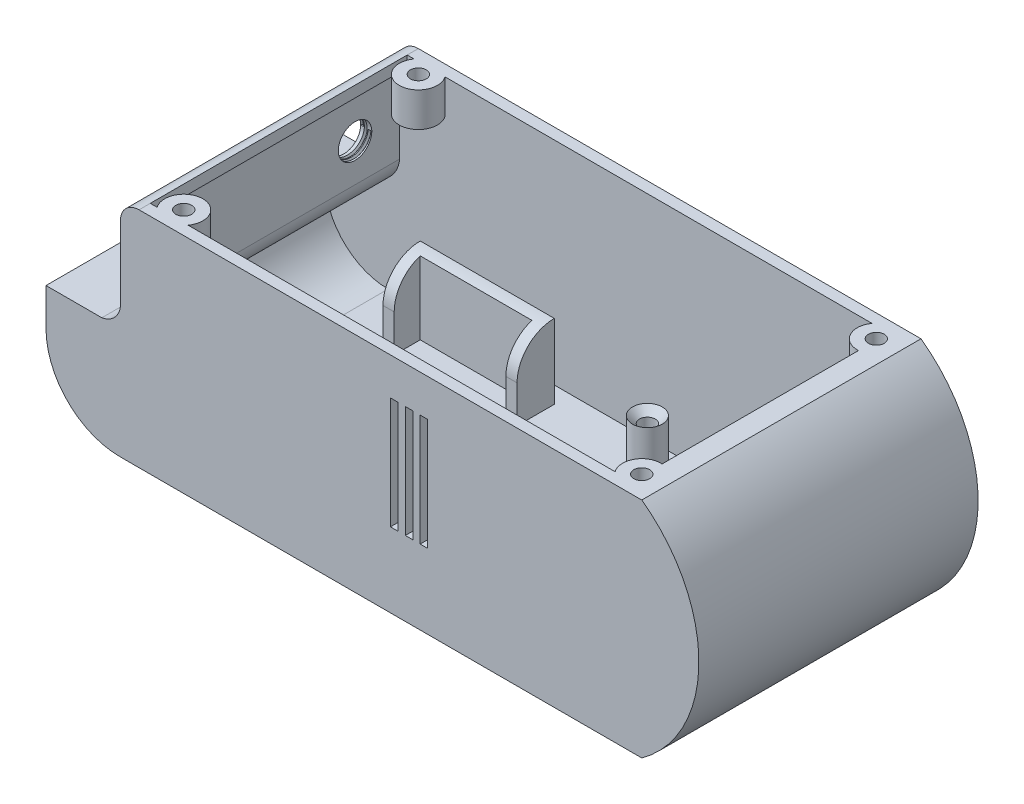
from build123d import *

# Parameters (mm, degrees)
BOSS_EXTRUDE1_DEPTH                               = 37.5
F_4_0MM_DOWEL_HOLE1_D                             = 4.25
F_4_0MM_DOWEL_HOLE1_DEPTH                         = 7.523171185
F_4_0MM_DOWEL_HOLE1_TIP                           = 1.276828815
SHELL1_START                                      = -34.5
SHELL1_DEPTH                                      = 69
SKETCH13_R                                        = 4
BOSS_EXTRUDE2_DEPTH                               = 15
CSK_FOR_M3_5_FLAT_HEAD_MACHINE_SCREW1_D           = 4.25
CSK_FOR_M3_5_FLAT_HEAD_MACHINE_SCREW1_DEPTH       = 8.723171185
CSK_FOR_M3_5_FLAT_HEAD_MACHINE_SCREW1_CSINK_D     = 8.2
CSK_FOR_M3_5_FLAT_HEAD_MACHINE_SCREW1_CSINK_ANGLE = 90
CSK_FOR_M3_5_FLAT_HEAD_MACHINE_SCREW1_TIP         = 1.276828815
BOSS_EXTRUDE3_DEPTH                               = 20
BOSS_EXTRUDE4_DEPTH                               = 20
FILLET1_R                                         = 10
FILLET2_R                                         = 10
SKETCH24_R                                        = 4.5
CUT_EXTRUDE2_DEPTH                                = 5
THREAD1_PITCH                                     = 1
SKETCH35_W                                        = 2
SKETCH35_H                                        = 30
CUT_EXTRUDE3_DEPTH                                = 5


with BuildPart() as part:
    # Sketch2 → Boss-Extrude1 (new, symmetric)
    with BuildSketch(Plane.XY):
        with BuildLine():
            Line((0, 0), (0, 20))
            ThreePointArc((0, 20), (1.464466094, 23.535533906), (5, 25))
            Line((5, 25), (140, 25))
            ThreePointArc((140, 25), (155.343592172, -5), (140, -35))
            Line((140, -35), (9.888535261, -35))
            Line((9.888535261, -35), (-0.111464739, -35))
            ThreePointArc((-0.111464739, -35), (-14.17478289, -29.17478289), (-20, -15.111464739))
            Line((-20, -15.111464739), (-20, -5.111464739))
            Line((-20, -5.111464739), (-5, -5.111464739))
            ThreePointArc((-5, -5.111464739), (-1.655416522, -3.381898176), (0, 0))
        make_face()
    extrude(amount=BOSS_EXTRUDE1_DEPTH, both=True)

    # Ø4.0mm Dowel Hole1
    with Locations(Plane(origin=(0, 25, 0), x_dir=(1, 0, 0), z_dir=(0, 1, 0))):
        with Locations((11, 31.5), (11, -31.5), (134, -31.5), (134, 31.5)):
            Hole(F_4_0MM_DOWEL_HOLE1_D / 2, depth=F_4_0MM_DOWEL_HOLE1_DEPTH)
            with Locations((0, 0, -(F_4_0MM_DOWEL_HOLE1_DEPTH + F_4_0MM_DOWEL_HOLE1_TIP / 2))):  # 118° drill point
                Cone(0, F_4_0MM_DOWEL_HOLE1_D / 2, F_4_0MM_DOWEL_HOLE1_TIP, mode=Mode.SUBTRACT)

    # Shell1: read off the stored shape, not the designer's step
    # Shell1 outline → Shell1 (cut)
    with BuildSketch(Plane.XY.offset(SHELL1_START)):
        with BuildLine():
            Line((5, 25), (5, 22))
            ThreePointArc((5, 22), (3.585786438, 21.414213562), (3, 20))
            Line((3, 20), (3, -0.183649605))
            ThreePointArc((3, -0.183649605), (0.476363339, -5.492759933), (-4.786504663, -8.111464739))
            Line((-4.786504663, -8.111464739), (-17, -8.111464739))
            Line((-17, -8.111464739), (-17, -15.111464739))
            ThreePointArc((-17, -15.111464739), (-12.053462546, -27.053462546), (-0.111464739, -32))
            Line((-0.111464739, -32), (139.007570492, -32))
            ThreePointArc((139.007570492, -32), (152.230342187, -2.227244432), (134.343592172, 25))
            Line((134.343592172, 25), (5, 25))
        make_face()
    extrude(amount=SHELL1_DEPTH, mode=Mode.SUBTRACT)

    # Shell1 2 outline → Shell1 2 (revolve)
    with BuildSketch(Plane(origin=(134, 0, -31.5), x_dir=(1, 0, 0), z_dir=(0, 0, 1))):
        Polygon((0, 12.700099808), (5.125, 15.779510481), (5.125, 25), (2.125, 25), (2.125, 17.476828815), (0, 16.2), align=None)
    revolve(axis=Axis((134, 0, -31.5), (0, 1, 0)))

    # Shell1 3 outline → Shell1 3 (revolve)
    with BuildSketch(Plane(origin=(134, 0, 31.5), x_dir=(1, 0, 0), z_dir=(0, 0, 1))):
        Polygon((0, 12.700099808), (5.125, 15.779510481), (5.125, 25), (2.125, 25), (2.125, 17.476828815), (0, 16.2), align=None)
    revolve(axis=Axis((134, 0, 31.5), (0, 1, 0)))

    # Shell1 4 outline → Shell1 4 (revolve)
    with BuildSketch(Plane(origin=(11, 0, 31.5), x_dir=(1, 0, 0), z_dir=(0, 0, 1))):
        Polygon((0, 12.700099808), (5.125, 15.779510481), (5.125, 25), (2.125, 25), (2.125, 17.476828815), (0, 16.2), align=None)
    revolve(axis=Axis((11, 0, 31.5), (0, 1, 0)))

    # Shell1 5 outline → Shell1 5 (revolve)
    with BuildSketch(Plane(origin=(11, 0, -31.5), x_dir=(1, 0, 0), z_dir=(0, 0, 1))):
        Polygon((0, 12.700099808), (5.125, 15.779510481), (5.125, 25), (2.125, 25), (2.125, 17.476828815), (0, 16.2), align=None)
    revolve(axis=Axis((11, 0, -31.5), (0, 1, 0)))

    # Sketch13 → Boss-Extrude2 (add)
    with BuildSketch(Plane(origin=(0, -32, 0), x_dir=(1, 0, 0), z_dir=(0, 1, 0))):
        with Locations((79.007570492, 25)):
            Circle(SKETCH13_R)
        with Locations((124.007570492, 25)):
            Circle(SKETCH13_R)
        with Locations((79.007570492, -25)):
            Circle(SKETCH13_R)
        with Locations((124.007570492, -25)):
            Circle(SKETCH13_R)
    extrude(amount=BOSS_EXTRUDE2_DEPTH)

    # CSK for M3.5 Flat Head Machine Screw1
    with Locations(Plane(origin=(0, -17, 0), x_dir=(1, 0, 0), z_dir=(0, 1, 0))):
        with Locations((79.007570492, 25), (79.007570492, -25), (124.007570492, -25), (124.007570492, 25)):
            CounterSinkHole(CSK_FOR_M3_5_FLAT_HEAD_MACHINE_SCREW1_D / 2, CSK_FOR_M3_5_FLAT_HEAD_MACHINE_SCREW1_CSINK_D / 2, depth=CSK_FOR_M3_5_FLAT_HEAD_MACHINE_SCREW1_DEPTH, counter_sink_angle=CSK_FOR_M3_5_FLAT_HEAD_MACHINE_SCREW1_CSINK_ANGLE)
            with Locations((0, 0, -(CSK_FOR_M3_5_FLAT_HEAD_MACHINE_SCREW1_DEPTH + CSK_FOR_M3_5_FLAT_HEAD_MACHINE_SCREW1_TIP / 2))):  # 118° drill point
                Cone(0, CSK_FOR_M3_5_FLAT_HEAD_MACHINE_SCREW1_D / 2, CSK_FOR_M3_5_FLAT_HEAD_MACHINE_SCREW1_TIP, mode=Mode.SUBTRACT)

    # Sketch22 → Boss-Extrude3 (add)
    with BuildSketch(Plane(origin=(0, -32, 0), x_dir=(1, 0, 0), z_dir=(0, 1, 0))):
        Polygon((13.007570492, 30), (49.007570492, 30), (49.007570492, 20), (46.007570492, 20), (46.007570492, 27), (16.007570492, 27), (16.007570492, 20), (13.007570492, 20), align=None)
    extrude(amount=BOSS_EXTRUDE3_DEPTH)

    # Sketch23 → Boss-Extrude4 (add)
    with BuildSketch(Plane(origin=(0, -32, 0), x_dir=(1, 0, 0), z_dir=(0, 1, 0))):
        Polygon((49.007570492, -30), (13.007570492, -30), (13.007570492, -20), (16.007570492, -20), (16.007570492, -27), (46.007570492, -27), (46.007570492, -20), (49.007570492, -20), align=None)
    extrude(amount=BOSS_EXTRUDE4_DEPTH)

    # Fillet1
    fillet1_edges = [part.edges().sort_by_distance(p)[0] for p in [
        (14.507570492, -12, -20),
    ]]
    fillet(fillet1_edges, radius=FILLET1_R - 0.0001)  # a hair under: the kernel refuses the full size

    # Fillet2
    fillet2_edges = [part.edges().sort_by_distance(p)[0] for p in [
        (47.507570492, -12, 20),
    ]]
    fillet(fillet2_edges, radius=FILLET2_R - 0.0001)  # a hair under: the kernel refuses the full size

    # Sketch24 → Cut-Extrude2 (cut)
    with BuildSketch(Plane.ZY):
        with Locations((-22.5, 10)):
            Circle(SKETCH24_R)
    extrude(amount=-CUT_EXTRUDE2_DEPTH, mode=Mode.SUBTRACT)

    # Thread1: arcs per turn and ends read off the stored shape
    # Thread1: the profile of Thread Profile1 profile screwed along a right-hand helix through 2 turns, 8 arcs to a turn; built about Z, then put on its axis
    thread1_z = Axis((0, 0, 0), (0, 0, 1))
    thread1_corners = [(4.4997, 0, -0.000173205), (5.041265875, 0, 0.312499999), (5.041265875, 0, 0.437499999), (4.4997, 0, 0.750173202)]
    with BuildLine(mode=Mode.PRIVATE) as thread1_profile:
        Line(thread1_corners[0], thread1_corners[1])
        Line(thread1_corners[1], thread1_corners[2])
        Line(thread1_corners[2], thread1_corners[3])
        Line(thread1_corners[3], thread1_corners[0])
    thread1_cap = Face(thread1_profile.wire())
    thread1_turn_angles = [0, 22.5, 45, 67.5, 90, 112.5, 135, 157.5, 180, 202.5, 225, 247.5, 270, 292.5, 315, 337.5, 360]
    thread1_turn_weights = [1, 0.9238795325112867, 1, 0.9238795325112867, 1, 0.9238795325112867, 1, 0.9238795325112867, 1, 0.9238795325112867, 1, 0.9238795325112867, 1, 0.9238795325112867, 1, 0.9238795325112867, 1]
    thread1_turn_rails = [Edge.make_bspline([Vector(p[0], p[1], 0).rotate(thread1_z, thread1_turn_angles[k]) / thread1_turn_weights[k] + Vector(0, 0, p[2] + THREAD1_PITCH * thread1_turn_angles[k] / 360) for k in range(17)], [0, 0, 0, 1, 1, 2, 2, 3, 3, 4, 4, 5, 5, 6, 6, 7, 7, 8, 8, 8], 2, thread1_turn_weights) for p in thread1_corners]
    thread1_turn_sides = [Face.make_surface_from_curves(thread1_turn_rails[p[0]], thread1_turn_rails[p[1]]) for p in [(0, 1), (1, 2), (2, 3), (3, 0)]]
    thread1 = Plane(origin=(0, 10, -22.5), x_dir=(0, 0, -1), z_dir=(1, 0, 0)) * Solid(Shell([*[p.moved(Location((0, 0, THREAD1_PITCH * i))) for i in range(2) for p in thread1_turn_sides], thread1_cap, thread1_cap.rotate(thread1_z, 720).moved(Location((0, 0, THREAD1_PITCH * 720 / 360)))]))
    add(thread1, mode=Mode.SUBTRACT)

    # Sketch35 → Cut-Extrude3 (cut)
    with BuildSketch(Plane.XY.offset(37.5)):
        with Locations((73.5, 0)):
            Rectangle(SKETCH35_W, SKETCH35_H)
        with Locations((77.5, 0)):
            Rectangle(SKETCH35_W, SKETCH35_H)
        with Locations((81.5, 0)):
            Rectangle(SKETCH35_W, SKETCH35_H)
    extrude(amount=-CUT_EXTRUDE3_DEPTH, mode=Mode.SUBTRACT)


solid = part.part
